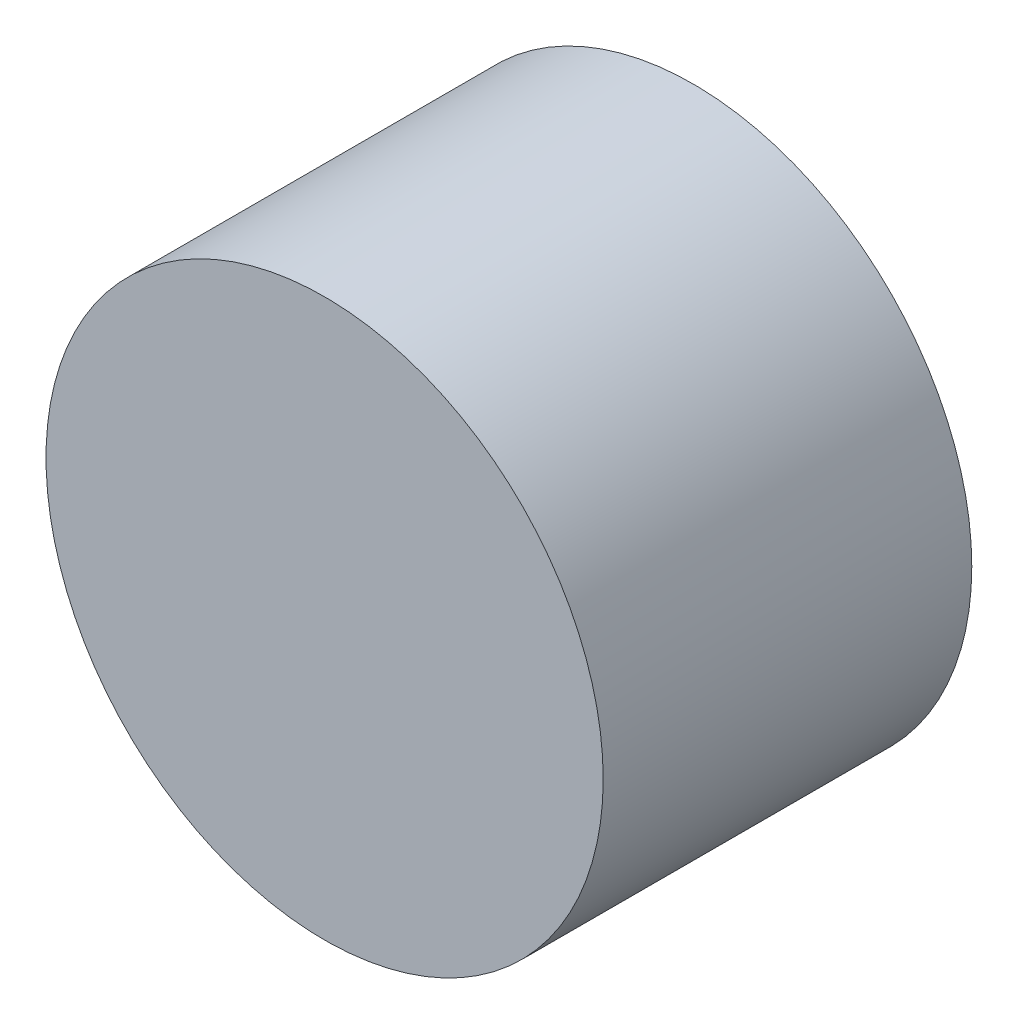
from build123d import *

# Parameters (mm, degrees)
SKETCH1_R           = 32.5
BOSS_EXTRUDE1_DEPTH = 43


with BuildPart() as part:
    # Sketch1 → Boss-Extrude1 (new body)
    with BuildSketch(Plane.XY):
        Circle(SKETCH1_R)
    extrude(amount=BOSS_EXTRUDE1_DEPTH)


solid = part.part
